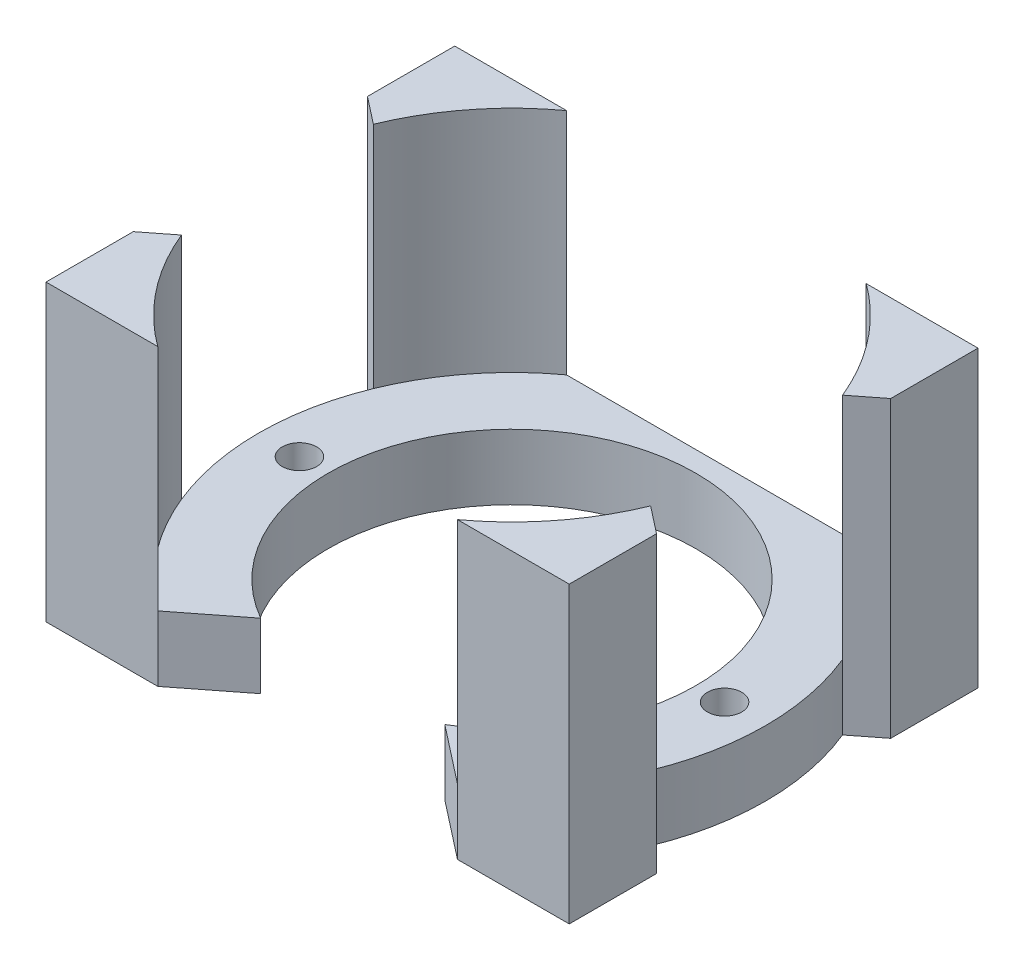
from build123d import *

# Parameters (mm, degrees)
SKETCH1_R           = 2.1
BOSS_EXTRUDE1_DEPTH = 8
BOSS_EXTRUDE2_DEPTH = 36


with BuildPart() as part:
    # Sketch1 → Boss-Extrude1 (new body)
    with BuildSketch(Plane(origin=(0, 0, 0), x_dir=(1, 0, 0), z_dir=(0, 1, 0))):
        with BuildLine():
            Line((18.33030278, -25), (32, -25))
            Line((32, -25), (32, -14.320549047))
            Line((32, -14.320549047), (28.692414075, -11.736497543))
            ThreePointArc((28.692414075, -11.736497543), (31, 0), (28.692414075, 11.736497543))
            Line((28.692414075, 11.736497543), (32, 14.320549047))
            Line((32, 14.320549047), (32, 25))
            Line((32, 25), (-32, 25))
            Line((-32, 25), (-32, 14.320549047))
            Line((-32, 14.320549047), (-28.692414075, 11.736497543))
            ThreePointArc((-28.692414075, 11.736497543), (-31, 0), (-28.692414075, -11.736497543))
            Line((-28.692414075, -11.736497543), (-32, -14.320549047))
            Line((-32, -14.320549047), (-32, -25))
            Line((-32, -25), (-18.33030278, -25))
            Line((-18.33030278, -25), (-11.262551698, -19.478319467))
            ThreePointArc((-11.262551698, -19.478319467), (0, 22.5), (11.262551698, -19.478319467))
            Line((11.262551698, -19.478319467), (18.33030278, -25))
        make_face()
        with Locations((26, 0)):
            Circle(SKETCH1_R, mode=Mode.SUBTRACT)
        with Locations((-26, 0)):
            Circle(SKETCH1_R, mode=Mode.SUBTRACT)
    extrude(amount=BOSS_EXTRUDE1_DEPTH)

    # Sketch1<4> → Boss-Extrude2 (add)
    with BuildSketch(Plane(origin=(0, 0, 0), x_dir=(1, 0, 0), z_dir=(0, 1, 0))):
        with BuildLine():
            Line((18.33030278, -25), (32, -25))
            Line((32, -25), (32, -14.320549047))
            Line((32, -14.320549047), (28.692414075, -11.736497543))
            ThreePointArc((28.692414075, -11.736497543), (24.428755585, -19.084965301), (18.33030278, -25))
        make_face()
        with BuildLine():
            Line((-32, -25), (-18.33030278, -25))
            ThreePointArc((-18.33030278, -25), (-24.428755585, -19.084965301), (-28.692414075, -11.736497543))
            Line((-28.692414075, -11.736497543), (-32, -14.320549047))
            Line((-32, -14.320549047), (-32, -25))
        make_face()
        with BuildLine():
            Line((28.692414075, 11.736497543), (32, 14.320549047))
            Line((32, 14.320549047), (32, 25))
            Line((32, 25), (18.33030278, 25))
            ThreePointArc((18.33030278, 25), (24.428755585, 19.084965301), (28.692414075, 11.736497543))
        make_face()
        with BuildLine():
            Line((-32, 25), (-32, 14.320549047))
            Line((-32, 14.320549047), (-28.692414075, 11.736497543))
            ThreePointArc((-28.692414075, 11.736497543), (-24.428755585, 19.084965301), (-18.33030278, 25))
            Line((-18.33030278, 25), (-32, 25))
        make_face()
    extrude(amount=BOSS_EXTRUDE2_DEPTH)


solid = part.part
